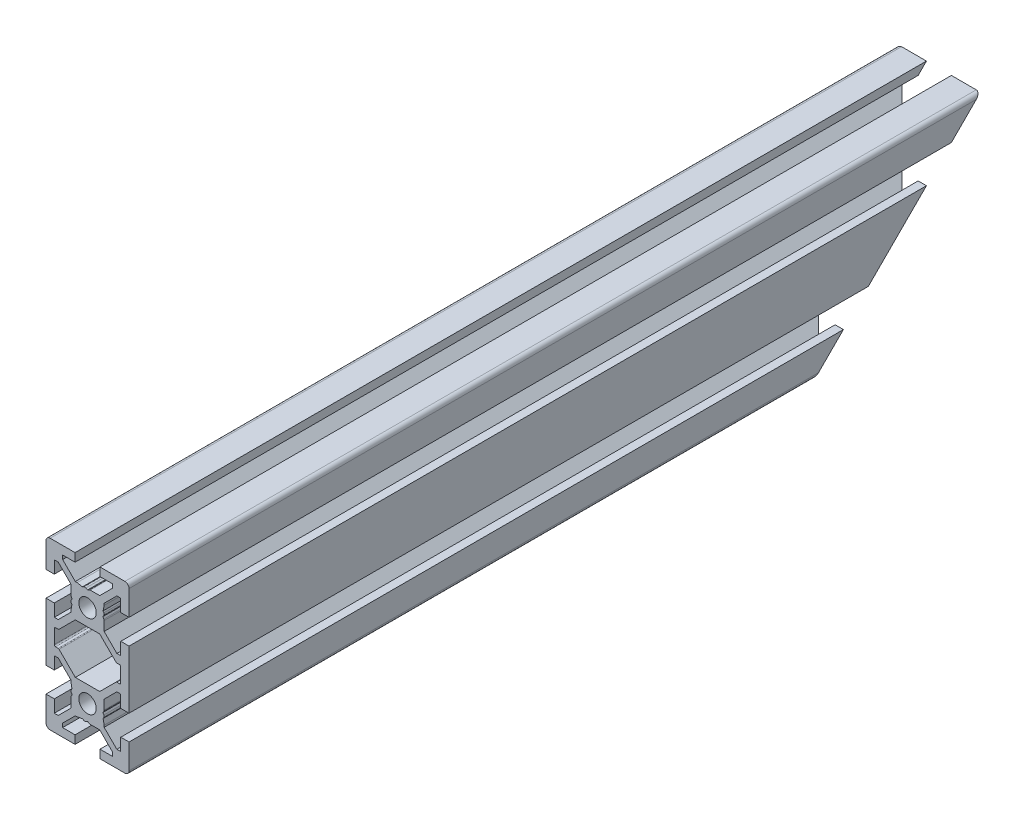
from build123d import *

# Parameters (mm, degrees)
SKETCH1_R           = 2.1
BOSS_EXTRUDE1_DEPTH = 205.03
CUT_EXTRUDE1_DEPTH  = 601.666296707


with BuildPart() as part:
    # Sketch1 → Boss-Extrude1 (new body)
    with BuildSketch(Plane(origin=(0, 0, -600), x_dir=(-1, 0, 0), z_dir=(0, 0, -1))):
        with BuildLine():
            Line((10, -7), (10, 7))
            Line((10, 7), (8, 7))
            Line((8, 7), (8, 4))
            Line((8, 4), (7.060660172, 4))
            Line((7.060660172, 4), (4, 7.060660172))
            Line((4, 7.060660172), (4, 7.5))
            Line((4, 7.5), (3.750976592, 8.781114371))
            Line((3.750976592, 8.781114371), (3.933012702, 9.096410162))
            ThreePointArc((3.933012702, 9.096410162), (4, 9.346410162), (3.933012702, 9.596410162))
            Line((3.933012702, 9.596410162), (3.7, 10))
            Line((3.7, 10), (3.933012702, 10.403589838))
            ThreePointArc((3.933012702, 10.403589838), (3.982962913, 10.524180316), (4, 10.653589838))
            Line((4, 10.653589838), (4, 12.939339828))
            Line((4, 12.939339828), (7.060660172, 16))
            Line((7.060660172, 16), (8, 16))
            Line((8, 16), (8, 13))
            Line((8, 13), (10, 13))
            Line((10, 13), (10, 19))
            ThreePointArc((10, 19), (9.707106781, 19.707106781), (9, 20))
            Line((9, 20), (3, 20))
            Line((3, 20), (3, 18))
            Line((3, 18), (6, 18))
            Line((6, 18), (6, 17.060660172))
            Line((6, 17.060660172), (2.939339828, 14))
            Line((2.939339828, 14), (2.5, 14))
            Line((2.5, 14), (1.218885629, 13.750976592))
            Line((1.218885629, 13.750976592), (0.903589838, 13.933012702))
            ThreePointArc((0.903589838, 13.933012702), (0.653589838, 14), (0.403589838, 13.933012702))
            Line((0.403589838, 13.933012702), (0, 13.7))
            Line((0, 13.7), (-0.403589838, 13.933012702))
            ThreePointArc((-0.403589838, 13.933012702), (-0.524180316, 13.982962913), (-0.653589838, 14))
            Line((-0.653589838, 14), (-2.939339828, 14))
            Line((-2.939339828, 14), (-6, 17.060660172))
            Line((-6, 17.060660172), (-6, 18))
            Line((-6, 18), (-3, 18))
            Line((-3, 18), (-3, 20))
            Line((-3, 20), (-9, 20))
            ThreePointArc((-9, 20), (-9.707106781, 19.707106781), (-10, 19))
            Line((-10, 19), (-10, 13))
            Line((-10, 13), (-8, 13))
            Line((-8, 13), (-8, 16))
            Line((-8, 16), (-7.060660172, 16))
            Line((-7.060660172, 16), (-4, 12.939339828))
            Line((-4, 12.939339828), (-4, 12.5))
            Line((-4, 12.5), (-3.750976592, 11.218885629))
            Line((-3.750976592, 11.218885629), (-3.933012702, 10.903589838))
            ThreePointArc((-3.933012702, 10.903589838), (-4, 10.653589838), (-3.933012702, 10.403589838))
            Line((-3.933012702, 10.403589838), (-3.7, 10))
            Line((-3.7, 10), (-3.933012702, 9.596410162))
            ThreePointArc((-3.933012702, 9.596410162), (-3.982962913, 9.475819684), (-4, 9.346410162))
            Line((-4, 9.346410162), (-4, 7.060660172))
            Line((-4, 7.060660172), (-7.060660172, 4))
            Line((-7.060660172, 4), (-8, 4))
            Line((-8, 4), (-8, 7))
            Line((-8, 7), (-10, 7))
            Line((-10, 7), (-10, -7))
            Line((-10, -7), (-8, -7))
            Line((-8, -7), (-8, -4))
            Line((-8, -4), (-7.060660172, -4))
            Line((-7.060660172, -4), (-4, -7.060660172))
            Line((-4, -7.060660172), (-4, -9.346410162))
            ThreePointArc((-4, -9.346410162), (-3.982962913, -9.475819684), (-3.933012702, -9.596410162))
            Line((-3.933012702, -9.596410162), (-3.7, -10))
            Line((-3.7, -10), (-3.933012702, -10.403589838))
            ThreePointArc((-3.933012702, -10.403589838), (-4, -10.653589838), (-3.933012702, -10.903589838))
            Line((-3.933012702, -10.903589838), (-3.750976592, -11.218885629))
            Line((-3.750976592, -11.218885629), (-4, -12.5))
            Line((-4, -12.5), (-4, -12.939339828))
            Line((-4, -12.939339828), (-7.060660172, -16))
            Line((-7.060660172, -16), (-8, -16))
            Line((-8, -16), (-8, -13))
            Line((-8, -13), (-10, -13))
            Line((-10, -13), (-10, -19))
            ThreePointArc((-10, -19), (-9.707106781, -19.707106781), (-9, -20))
            Line((-9, -20), (-3, -20))
            Line((-3, -20), (-3, -18))
            Line((-3, -18), (-6, -18))
            Line((-6, -18), (-6, -17.060660172))
            Line((-6, -17.060660172), (-2.939339828, -14))
            Line((-2.939339828, -14), (-0.653589838, -14))
            ThreePointArc((-0.653589838, -14), (-0.524180316, -13.982962913), (-0.403589838, -13.933012702))
            Line((-0.403589838, -13.933012702), (0, -13.7))
            Line((0, -13.7), (0.403589839, -13.933012702))
            ThreePointArc((0.403589839, -13.933012702), (0.653589839, -14), (0.903589838, -13.933012702))
            Line((0.903589838, -13.933012702), (1.218885629, -13.750976592))
            Line((1.218885629, -13.750976592), (2.5, -14))
            Line((2.5, -14), (2.939339828, -14))
            Line((2.939339828, -14), (6, -17.060660172))
            Line((6, -17.060660172), (6, -18))
            Line((6, -18), (3, -18))
            Line((3, -18), (3, -20))
            Line((3, -20), (9, -20))
            ThreePointArc((9, -20), (9.707106781, -19.707106781), (10, -19))
            Line((10, -19), (10, -13))
            Line((10, -13), (8, -13))
            Line((8, -13), (8, -16))
            Line((8, -16), (7.060660172, -16))
            Line((7.060660172, -16), (4, -12.939339828))
            Line((4, -12.939339828), (4, -10.653589838))
            ThreePointArc((4, -10.653589838), (3.982962913, -10.524180316), (3.933012702, -10.403589838))
            Line((3.933012702, -10.403589838), (3.7, -10))
            Line((3.7, -10), (3.933012702, -9.596410162))
            ThreePointArc((3.933012702, -9.596410162), (4, -9.346410162), (3.933012702, -9.096410162))
            Line((3.933012702, -9.096410162), (3.750976592, -8.781114371))
            Line((3.750976592, -8.781114371), (4, -7.5))
            Line((4, -7.5), (4, -7.060660172))
            Line((4, -7.060660172), (7.060660172, -4))
            Line((7.060660172, -4), (8, -4))
            Line((8, -4), (8, -7))
            Line((8, -7), (10, -7))
        make_face()
        with Locations((0, -10)):
            Circle(SKETCH1_R, mode=Mode.SUBTRACT)
        with Locations((0, 10)):
            Circle(SKETCH1_R, mode=Mode.SUBTRACT)
        with BuildLine():
            Line((8, 1.7), (8, -1.7))
            ThreePointArc((8, -1.7), (7.912132034, -1.912132034), (7.7, -2))
            Line((7.7, -2), (7.063603897, -2))
            ThreePointArc((7.063603897, -2), (6.948798867, -2.02283614), (6.851471863, -2.087867966))
            Line((6.851471863, -2.087867966), (2.939339828, -6))
            Line((2.939339828, -6), (-2.939339828, -6))
            Line((-2.939339828, -6), (-6.851471863, -2.087867966))
            ThreePointArc((-6.851471863, -2.087867966), (-6.948798867, -2.02283614), (-7.063603897, -2))
            Line((-7.063603897, -2), (-7.7, -2))
            ThreePointArc((-7.7, -2), (-7.912132034, -1.912132034), (-8, -1.7))
            Line((-8, -1.7), (-8, 1.7))
            ThreePointArc((-8, 1.7), (-7.912132034, 1.912132034), (-7.7, 2))
            Line((-7.7, 2), (-7.063603897, 2))
            ThreePointArc((-7.063603897, 2), (-6.948798867, 2.02283614), (-6.851471863, 2.087867966))
            Line((-6.851471863, 2.087867966), (-2.939339828, 6))
            Line((-2.939339828, 6), (2.939339828, 6))
            Line((2.939339828, 6), (6.851471863, 2.087867966))
            ThreePointArc((6.851471863, 2.087867966), (6.948798867, 2.02283614), (7.063603897, 2))
            Line((7.063603897, 2), (7.7, 2))
            ThreePointArc((7.7, 2), (7.912132034, 1.912132034), (8, 1.7))
        make_face(mode=Mode.SUBTRACT)
    extrude(amount=-BOSS_EXTRUDE1_DEPTH)

    # Sketch2 → Cut-Extrude1 (cut, through all)
    with BuildSketch(Plane.ZY.offset(10)):
        Polygon((-600, 20), (-560, -20), (-600, -20), align=None)
    extrude(amount=-CUT_EXTRUDE1_DEPTH, mode=Mode.SUBTRACT)


solid = part.part
